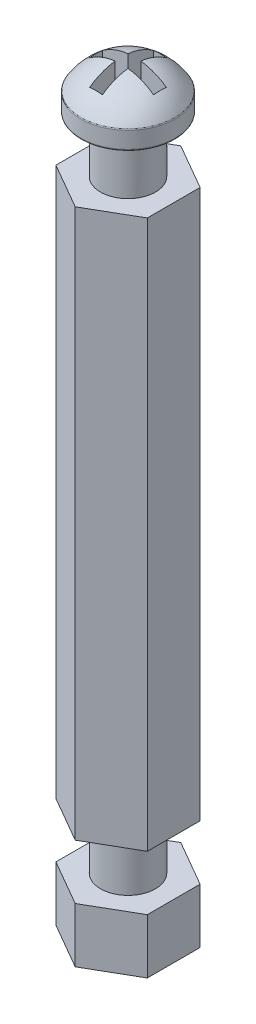
from build123d import *

# Parameters (mm, degrees)
BOSS_EXTRUDE1_DEPTH = 30
SKETCH1_4_R         = 1.5
BOSS_EXTRUDE2_DEPTH = 6
CUT_EXTRUDE1_DEPTH  = 7
FILLET1_R           = 0.1
SKETCH5_R           = 1.5
BOSS_EXTRUDE3_DEPTH = 3


with BuildPart() as part:
    # Sketch1 → Boss-Extrude1 (new body)
    with BuildSketch(Plane(origin=(0, 0, 0), x_dir=(1, 0, 0), z_dir=(0, 1, 0))):
        Polygon((2.5, -1.443375673), (2.5, 1.443375673), (0, 2.886751346), (-2.5, 1.443375673), (-2.5, -1.443375673), (0, -2.886751346), align=None)
    extrude(amount=BOSS_EXTRUDE1_DEPTH)

    # Sketch1<4> → Boss-Extrude2 (add)
    with BuildSketch(Plane(origin=(0, 0, 0), x_dir=(1, 0, 0), z_dir=(0, 1, 0))):
        Circle(SKETCH1_4_R)
    extrude(amount=-BOSS_EXTRUDE2_DEPTH)

    # Sketch3 → Revolve1 (revolve)
    with BuildSketch(Plane.XY):
        with BuildLine():
            Line((0, 30), (1.5, 30))
            Line((1.5, 30), (1.5, 33))
            Line((1.5, 33), (2.577677109, 33))
            Line((2.577677109, 33), (2.577677109, 34))
            ThreePointArc((2.577677109, 34), (2.572999109, 34.033876486), (2.559315248, 34.065217384))
            ThreePointArc((2.559315248, 34.065217384), (1.467028944, 35.116835126), (0, 35.5))
            Line((0, 35.5), (0, 30))
        make_face()
    revolve(axis=Axis((0, 30, 0), (0, -1, 0)))

    # Sketch4 → Cut-Extrude1 (cut)
    with BuildSketch(Plane(origin=(0, 40, 0), x_dir=(1, 0, 0), z_dir=(0, 1, 0))):
        Polygon((-1.75, 0.35), (-1.75, -0.35), (-0.35, -0.35), (-0.35, -1.75), (0.35, -1.75), (0.35, -0.35), (1.75, -0.35), (1.75, 0.35), (0.35, 0.35), (0.35, 1.75), (-0.35, 1.75), (-0.35, 0.35), align=None)
    extrude(amount=-CUT_EXTRUDE1_DEPTH, mode=Mode.SUBTRACT)

    # Fillet1
    fillet1_edges = [part.edges().sort_by_distance(p)[0] for p in [
        (-2.577677109, 33, 0),
    ]]
    fillet(fillet1_edges, radius=FILLET1_R)


with BuildPart() as body_2:
    # Sketch5 → Boss-Extrude3 (new body)
    with BuildSketch(Plane.XZ.offset(6)):
        Polygon((2.5, 1.443375673), (0, 2.886751346), (-2.5, 1.443375673), (-2.5, -1.443375673), (0, -2.886751346), (2.5, -1.443375673), align=None)
        Circle(SKETCH5_R, mode=Mode.SUBTRACT)
    extrude(amount=-BOSS_EXTRUDE3_DEPTH)


solid = Compound([part.part, body_2.part])
